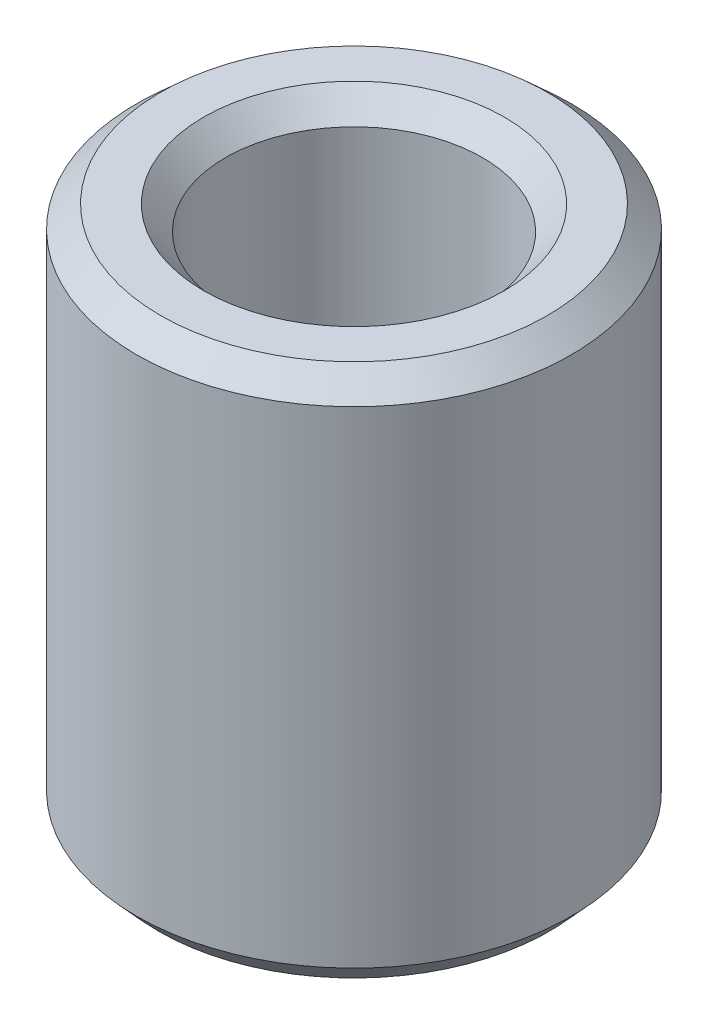
from build123d import *
from OCP.BRepFilletAPI import BRepFilletAPI_MakeChamfer

# Parameters (mm, degrees)
SKETCH1_R           = 37.5
BOSS_EXTRUDE1_DEPTH = 91.781059238
SKETCH2_R           = 22.150483096
CUT_EXTRUDE1_DEPTH  = 107.001239779
CHAMFER1_SIZE       = 3.783043771
CHAMFER1_SIZE2      = 4.145740892


with BuildPart() as part:
    # Sketch1 → Boss-Extrude1 (new body)
    with BuildSketch(Plane(origin=(0, 0, 0), x_dir=(1, 0, 0), z_dir=(0, 1, 0))):
        Circle(SKETCH1_R)
    extrude(amount=BOSS_EXTRUDE1_DEPTH)

    # Sketch2 → Cut-Extrude1 (cut, through all)
    with BuildSketch(Plane(origin=(0, 0, 0), x_dir=(1, 0, 0), z_dir=(0, 1, 0))):
        Circle(SKETCH2_R)
    extrude(amount=CUT_EXTRUDE1_DEPTH, mode=Mode.SUBTRACT)

    # Chamfer1: one chamfer whose edges measure the first distance from different faces: ONE call of the kernel's chamfer builder (chamfer() names one face for all edges)
    chamfer1_edges_1 = [part.edges().sort_by_distance(p)[0] for p in [
        (-22.150483096, 91.781059238, 0),
    ]]
    chamfer1_side_1 = [part.faces().sort_by_distance(p)[0] for p in [
        (-36.439339828, 91.781059238, 0),
    ]]
    chamfer1_edges_2 = [part.edges().sort_by_distance(p)[0] for p in [
        (-22.150483096, 0, 0),
    ]]
    chamfer1_side_2 = [part.faces().sort_by_distance(p)[0] for p in [
        (-22.150483096, 45.890529619, 0),
    ]]
    chamfer1_edges_3 = [part.edges().sort_by_distance(p)[0] for p in [
        (-37.5, 0, 0),
    ]]
    chamfer1_side_3 = [part.faces().sort_by_distance(p)[0] for p in [
        (-36.439339828, 0, 0),
    ]]
    chamfer1_edges_4 = [part.edges().sort_by_distance(p)[0] for p in [
        (-37.5, 91.781059238, 0),
    ]]
    chamfer1_side_4 = [part.faces().sort_by_distance(p)[0] for p in [
        (-37.5, 45.890529619, 0),
    ]]
    chamfer1 = BRepFilletAPI_MakeChamfer(part.part.solid().wrapped)
    for e in chamfer1_edges_1:
        chamfer1.Add(CHAMFER1_SIZE, CHAMFER1_SIZE2, e.wrapped, chamfer1_side_1[0].wrapped)  # the first distance lies on this face
    for e in chamfer1_edges_2:
        chamfer1.Add(CHAMFER1_SIZE, CHAMFER1_SIZE2, e.wrapped, chamfer1_side_2[0].wrapped)  # the first distance lies on this face
    for e in chamfer1_edges_3:
        chamfer1.Add(CHAMFER1_SIZE, CHAMFER1_SIZE2, e.wrapped, chamfer1_side_3[0].wrapped)  # the first distance lies on this face
    for e in chamfer1_edges_4:
        chamfer1.Add(CHAMFER1_SIZE, CHAMFER1_SIZE2, e.wrapped, chamfer1_side_4[0].wrapped)  # the first distance lies on this face
    add(Compound.cast(chamfer1.Shape()), mode=Mode.REPLACE)


solid = part.part
